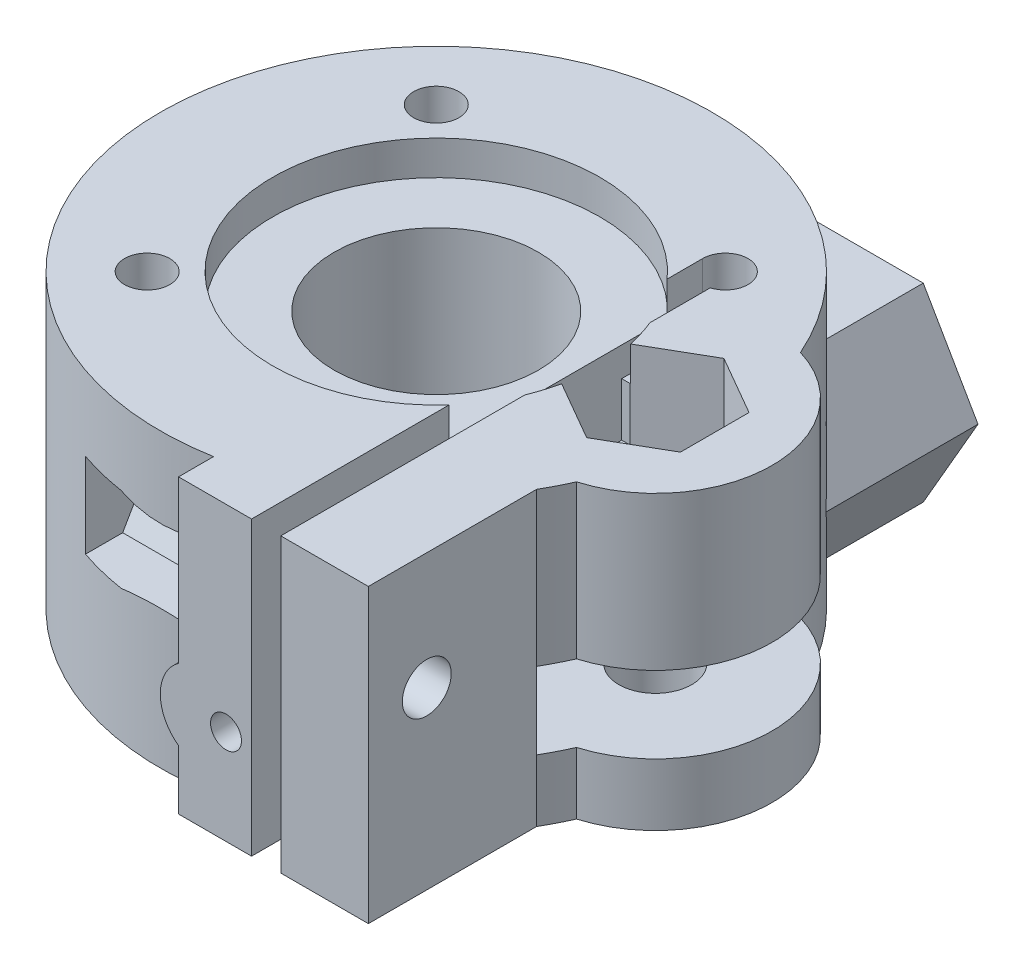
from build123d import *

# Parameters (mm, degrees)
SKETCH1_R                = 1.55
SKETCH1_R_2              = 7
SKETCH1_R_3              = 2.5
BOSS_EXTRUDE1_DEPTH      = 20
BOSS_EXTRUDE2_REACH      = 53.813
BOSS_EXTRUDE2_END_RADIUS = 18.9
BOSS_EXTRUDE3_REACH      = 55.526
BOSS_EXTRUDE3_END_RADIUS = 18.9
SKETCH3_W                = 6
SKETCH3_H                = 20
SKETCH5_R                = 1.675
CUT_EXTRUDE3_DEPTH       = 22.5
CUT_EXTRUDE4_DEPTH       = 11
CUT_EXTRUDE5_DEPTH       = 5.25
SKETCH8_R                = 1.06
CUT_EXTRUDE6_DEPTH       = 54.525694884
SKETCH9_R                = 3
CUT_EXTRUDE7_DEPTH       = 10
SKETCH11_R               = 11.2
CUT_EXTRUDE9_DEPTH       = 2.35
CUT_EXTRUDE8_DEPTH       = 6


with BuildPart() as part:
    # Sketch1 → Boss-Extrude1 (new body)
    with BuildSketch(Plane(origin=(0, 0, 0), x_dir=(1, 0, 0), z_dir=(0, 1, 0))):
        with BuildLine():
            Line((10.349494937, -15.814485593), (10.349494937, 8.416255239))
            ThreePointArc((10.349494937, 8.416255239), (10.822804202, 11.144484896), (8.349494937, 9.899494937))
            Line((8.349494937, 9.899494937), (8.349494937, -16.955705067))
            ThreePointArc((8.349494937, -16.955705067), (-17.76919177, 6.439396233), (17.273666667, 7.670100383))
            ThreePointArc((17.273666667, 7.670100383), (23, 0), (17.273666667, -7.670100383))
            ThreePointArc((17.273666667, -7.670100383), (14.399392933, -12.242037541), (10.349494937, -15.814485593))
        make_face()
        with Locations(Location((-9.899494937, 9.899494937, 0), (0, 0, 270))):
            Circle(SKETCH1_R, mode=Mode.SUBTRACT)
        with Locations(Location((-9.899494937, -9.899494937, 0), (0, 0, 270))):
            Circle(SKETCH1_R, mode=Mode.SUBTRACT)
        with Locations(Location((0, 0, 0), (0, 0, 270))):
            Circle(SKETCH1_R_2, mode=Mode.SUBTRACT)
        with Locations(Location((15, 0, 0), (0, 0, 270))):
            Circle(SKETCH1_R_3, mode=Mode.SUBTRACT)
    extrude(amount=BOSS_EXTRUDE1_DEPTH)

    # Boss-Extrude2: up to this cylinder (the profile starts outside it)
    boss_extrude2_end = Plane(origin=(0, 6.495191, 0), z_dir=(0, -1, 0)) * Cylinder(BOSS_EXTRUDE2_END_RADIUS, 146.426, mode=Mode.PRIVATE)
    # Sketch2 → Boss-Extrude2 (add, up to the surface)
    with BuildSketch(Plane.XY.offset(-23), mode=Mode.PRIVATE) as boss_extrude2_sk1:
        Polygon((14.1, 6.495190528), (10.35, 0), (2.85, 0), (-0.9, 6.495190528), (2.85, 12.990381057), (10.35, 12.990381057), align=None)
    boss_extrude2_tool1 = extrude(boss_extrude2_sk1.sketch, amount=BOSS_EXTRUDE2_REACH, mode=Mode.PRIVATE) - boss_extrude2_end
    add(boss_extrude2_tool1.solids().sort_by_distance((6.6, 6.495191, -23))[0])

    # Boss-Extrude3: up to this cylinder (the profile starts outside it)
    boss_extrude3_end = Plane(origin=(0, 9.928375, 0), z_dir=(0, -1, 0)) * Cylinder(BOSS_EXTRUDE3_END_RADIUS, 149.99525, mode=Mode.PRIVATE)
    # Sketch3 → Boss-Extrude3 (add, up to the surface)
    with BuildSketch(Plane.XY.offset(21), mode=Mode.PRIVATE) as boss_extrude3_sk1:
        with BuildLine():
            Line((8.349494937, 20), (3.349494937, 20))
            Line((3.349494937, 20), (3.349494937, 8.936698586))
            ThreePointArc((3.349494937, 8.936698586), (2.099494937, 6.5), (3.349494937, 4.063301414))
            Line((3.349494937, 4.063301414), (3.349494937, 0))
            Line((3.349494937, 0), (8.349494937, 0))
            Line((8.349494937, 0), (8.349494937, 20))
        make_face()
    boss_extrude3_tool1 = extrude(boss_extrude3_sk1.sketch, amount=-BOSS_EXTRUDE3_REACH, mode=Mode.PRIVATE) - boss_extrude3_end
    add(boss_extrude3_tool1.solids().sort_by_distance((5.726294, 9.85675, 21))[0])
    # Sketch3 → Boss-Extrude3 (add, up to the surface)
    with BuildSketch(Plane.XY.offset(21), mode=Mode.PRIVATE) as boss_extrude3_sk2:
        with Locations((13.349494937, 10)):
            Rectangle(SKETCH3_W, SKETCH3_H)
    boss_extrude3_tool2 = extrude(boss_extrude3_sk2.sketch, amount=-BOSS_EXTRUDE3_REACH, mode=Mode.PRIVATE) - boss_extrude3_end
    add(boss_extrude3_tool2.solids().sort_by_distance((13.349495, 10, 21))[0])

    # Sketch5 → Cut-Extrude3 (cut)
    with BuildSketch(Plane(origin=(16.349494937, 0, 0), x_dir=(0, 0, -1), z_dir=(1, 0, 0))):
        with Locations(Location((-17, 12, 0), (0, 0, 90))):
            Circle(SKETCH5_R)
    extrude(amount=-CUT_EXTRUDE3_DEPTH, mode=Mode.SUBTRACT)

    # Sketch6 → Cut-Extrude4 (cut)
    with BuildSketch(Plane(origin=(-6.150505063, 0, 0), x_dir=(0, 0, -1), z_dir=(1, 0, 0))):
        Polygon((-20.35, 12), (-18.675, 9.098814897), (-15.325, 9.098814897), (-13.65, 12), (-15.325, 14.901185103), (-18.675, 14.901185103), align=None)
    extrude(amount=CUT_EXTRUDE4_DEPTH, mode=Mode.SUBTRACT)

    # Sketch7 → Cut-Extrude5 (cut)
    with BuildSketch(Plane(origin=(0, 4.25, 0), x_dir=(1, 0, 0), z_dir=(0, 1, 0))):
        with BuildLine():
            Line((6.29798001, 4), (5.744562647, 4))
            Line((5.744562647, 4), (5.744562647, -4))
            Line((5.744562647, -4), (6.29798001, -4))
            ThreePointArc((6.29798001, -4), (24.577324882, 0), (6.29798001, 4))
        make_face()
    extrude(amount=CUT_EXTRUDE5_DEPTH, mode=Mode.SUBTRACT)

    # Sketch8 → Cut-Extrude6 (cut, through all)
    with BuildSketch(Plane(origin=(0, 0, -23), x_dir=(-1, 0, 0), z_dir=(0, 0, -1))):
        with Locations((-6.6, 6.495190528)):
            Circle(SKETCH8_R)
    extrude(amount=-CUT_EXTRUDE6_DEPTH, mode=Mode.SUBTRACT)

    # Sketch9 → Cut-Extrude7 (cut)
    with BuildSketch(Plane(origin=(0, 0, -23), x_dir=(-1, 0, 0), z_dir=(0, 0, -1))):
        with Locations((-6.6, 6.495190528)):
            Circle(SKETCH9_R)
    extrude(amount=-CUT_EXTRUDE7_DEPTH, mode=Mode.SUBTRACT)

    # Sketch11 → Cut-Extrude9 (cut)
    with BuildSketch(Plane(origin=(0, 20, 0), x_dir=(1, 0, 0), z_dir=(0, 1, 0))):
        Circle(SKETCH11_R)
    extrude(amount=-CUT_EXTRUDE9_DEPTH, mode=Mode.SUBTRACT)

    # Sketch10 → Cut-Extrude8 (cut)
    with BuildSketch(Plane(origin=(0, 20, 0), x_dir=(1, 0, 0), z_dir=(0, 1, 0))):
        Polygon((15, 4.7), (10.929680602, 2.35), (10.349494937, 2.35), (10.349494937, -2.35), (10.929680602, -2.35), (15, -4.7), (19.070319398, -2.35), (19.070319398, 2.35), align=None)
    extrude(amount=-CUT_EXTRUDE8_DEPTH, mode=Mode.SUBTRACT)

    # Cut-Revolve1: read off the stored shape, not the designer's step
    # Cut-Revolve1: loft between two sections, ruled curve by curve
    cut_revolve1_from = [
        Edge.make_three_point_arc((7.653578644, 6.608263478, -9.001288479), (6.491231459, 7.554083708, -9.001288479), (5.545411229, 6.391736522, -9.001288479)),
        Edge.make_three_point_arc((5.545411229, 6.391736522, -9.001288479), (6.707758415, 5.445916292, -9.001288479), (7.653578644, 6.608263478, -9.001288479)),
    ]
    cut_revolve1_to = [
        Edge.make_three_point_arc((9.086412031, 6.755427811, -4), (6.344067126, 8.986917094, -4), (4.112577842, 6.244572189, -4)),
        Edge.make_three_point_arc((4.112577842, 6.244572189, -4), (6.854922748, 4.013082906, -4), (9.086412031, 6.755427811, -4)),
    ]
    cut_revolve1 = Solid(Shell([*[Face.make_surface_from_curves(cut_revolve1_from[k], cut_revolve1_to[k]) for k in range(2)], Face(Wire(cut_revolve1_from)), Face(Wire(cut_revolve1_to))]))
    add(cut_revolve1, mode=Mode.SUBTRACT)


solid = part.part
